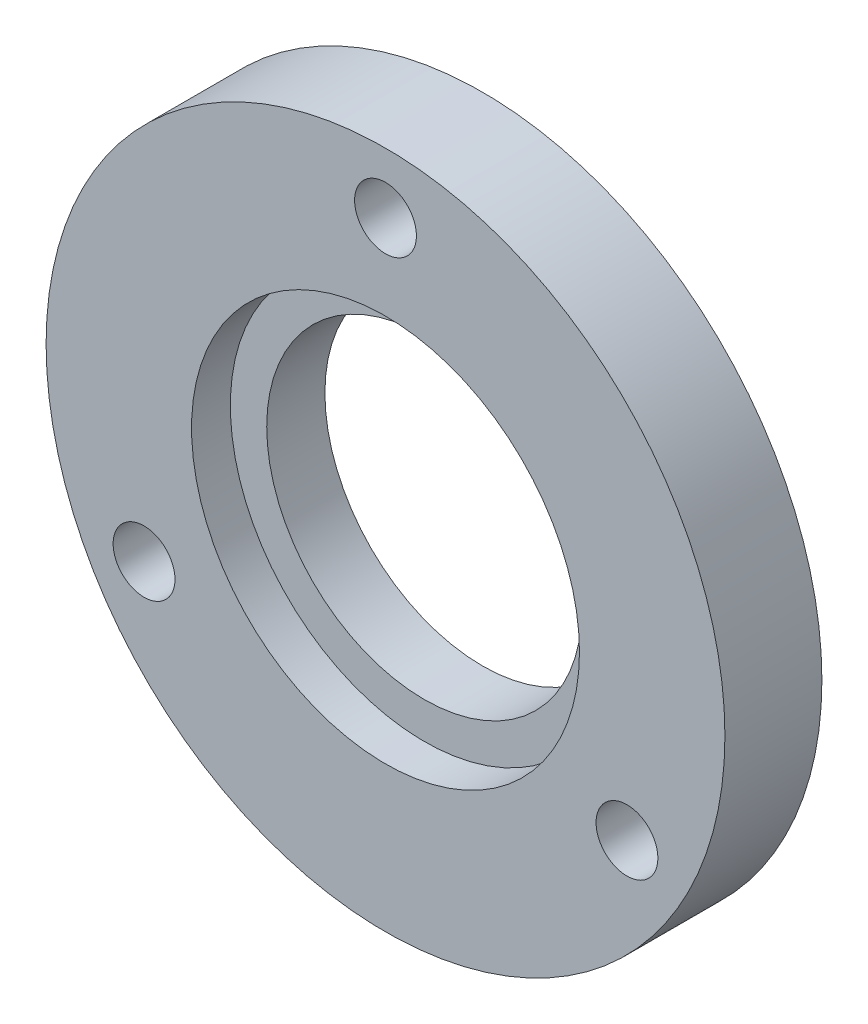
from build123d import *

# Parameters (mm, degrees)
SKETCH1_R           = 28
SKETCH1_R_2         = 2.55
SKETCH1_R_3         = 13
BOSS_EXTRUDE1_DEPTH = 8
SKETCH1_7_R         = 28
SKETCH1_7_R_2       = 2.55
SKETCH1_7_R_3       = 16
BOSS_EXTRUDE4_DEPTH = 8
SKETCH1_10_R        = 16
SKETCH1_10_R_2      = 13
CUT_EXTRUDE1_DEPTH  = 3.2


with BuildPart() as part:
    # Sketch1 → Boss-Extrude1 (new body)
    with BuildSketch(Plane.XY):
        Circle(SKETCH1_R)
        with Locations((-19.918584287, -11.5)):
            Circle(SKETCH1_R_2, mode=Mode.SUBTRACT)
        with Locations((19.918584287, -11.5)):
            Circle(SKETCH1_R_2, mode=Mode.SUBTRACT)
        with Locations((0, 23)):
            Circle(SKETCH1_R_2, mode=Mode.SUBTRACT)
        Circle(SKETCH1_R_3, mode=Mode.SUBTRACT)
    extrude(amount=-BOSS_EXTRUDE1_DEPTH)

    # Sketch1<7> → Boss-Extrude4 (add)
    with BuildSketch(Plane.XY):
        Circle(SKETCH1_7_R)
        with Locations((-19.918584287, -11.5)):
            Circle(SKETCH1_7_R_2, mode=Mode.SUBTRACT)
        with Locations((19.918584287, -11.5)):
            Circle(SKETCH1_7_R_2, mode=Mode.SUBTRACT)
        Circle(SKETCH1_7_R_3, mode=Mode.SUBTRACT)
        with Locations((0, 23)):
            Circle(SKETCH1_7_R_2, mode=Mode.SUBTRACT)
    extrude(amount=-BOSS_EXTRUDE4_DEPTH)

    # Sketch1<10> → Cut-Extrude1 (cut)
    with BuildSketch(Plane.XY):
        Circle(SKETCH1_10_R)
        Circle(SKETCH1_10_R_2, mode=Mode.SUBTRACT)
    extrude(amount=-CUT_EXTRUDE1_DEPTH, mode=Mode.SUBTRACT)


solid = part.part
